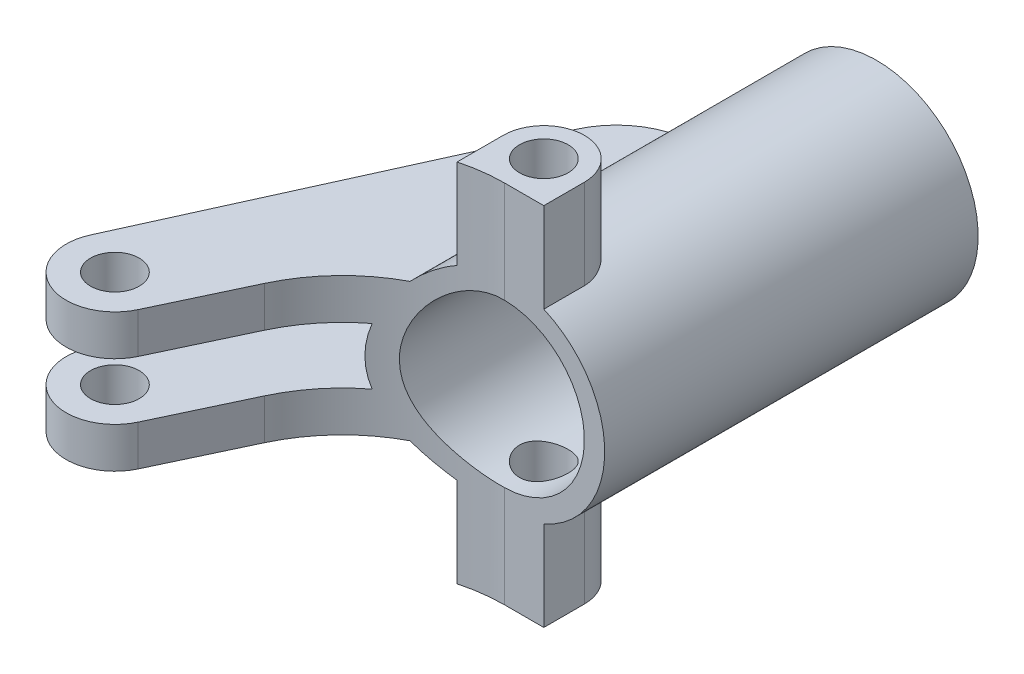
from build123d import *

# Parameters (mm, degrees)
CROQUIS1_R                   = 6.25
CROQUIS1_R_2                 = 5
SALIENTE_EXTRUIR1_DEPTH      = 15
SALIENTE_EXTRUIR2_REACH      = 25.881
SALIENTE_EXTRUIR2_END_RADIUS = 6.25
CROQUIS2_W                   = 5
CROQUIS2_H                   = 5
SALIENTE_EXTRUIR3_REACH      = 29.755
SALIENTE_EXTRUIR3_END_RADIUS = 6.25
CROQUIS3_W                   = 5
CROQUIS3_H                   = 5
CORTAR_EXTRUIR1_REACH        = 29.755
CROQUIS4_R                   = 1.5
REDONDEO1_R                  = 2.5
CROQUIS5_R                   = 1.5
SALIENTE_EXTRUIR4_DEPTH      = 2.5
SALIENTE_EXTRUIR5_REACH      = 34.452
CROQUIS6_W                   = 15
CROQUIS6_H                   = 2.5
CROQUIS7_R                   = 1.5
SALIENTE_EXTRUIR6_DEPTH      = 2.5
SALIENTE_EXTRUIR7_REACH      = 34.452
SALIENTE_EXTRUIR7_END_RADIUS = 6.25
CROQUIS8_W                   = 15
CROQUIS8_H                   = 2.5
REDONDEO2_R                  = 5
REDONDEO4_R                  = 10
SALIENTE_EXTRUIR9_REACH      = 43.224
CROQUIS10_R                  = 6.25
CROQUIS10_R_2                = 5


# Some blends are built 0.0001 mm under size
with BuildPart() as part:
    # Croquis1 → Saliente-Extruir1 (new body)
    with BuildSketch(Plane.XY):
        Circle(CROQUIS1_R)
        Circle(CROQUIS1_R_2, mode=Mode.SUBTRACT)
    extrude(amount=SALIENTE_EXTRUIR1_DEPTH)

    # Saliente-Extruir2: up to this cylinder (the profile starts outside it)
    saliente_extruir2_end = Plane(origin=(0, 0, 12.5), z_dir=(0, 0, -1)) * Cylinder(SALIENTE_EXTRUIR2_END_RADIUS, 65.262, mode=Mode.PRIVATE)
    # Croquis2 → Saliente-Extruir2 (add, up to the surface)
    with BuildSketch(Plane(origin=(0, 11.25, 0), x_dir=(1, 0, 0), z_dir=(0, 1, 0)), mode=Mode.PRIVATE) as saliente_extruir2_sk1:
        with Locations((0, -12.5)):
            Rectangle(CROQUIS2_W, CROQUIS2_H)
    saliente_extruir2_tool1 = extrude(saliente_extruir2_sk1.sketch, amount=-SALIENTE_EXTRUIR2_REACH, mode=Mode.PRIVATE) - saliente_extruir2_end
    add(saliente_extruir2_tool1.solids().sort_by_distance((0, 11.25, 12.5))[0])

    # Saliente-Extruir3: up to this cylinder (the profile starts outside it)
    saliente_extruir3_end = Plane(origin=(0, 0, 12.5), z_dir=(0, 0, -1)) * Cylinder(SALIENTE_EXTRUIR3_END_RADIUS, 73.01, mode=Mode.PRIVATE)
    # Croquis3 → Saliente-Extruir3 (add, up to the surface)
    with BuildSketch(Plane(origin=(0, -11.25, 0), x_dir=(1, 0, 0), z_dir=(0, 1, 0)), mode=Mode.PRIVATE) as saliente_extruir3_sk1:
        with Locations((0, -12.5)):
            Rectangle(CROQUIS3_W, CROQUIS3_H)
    saliente_extruir3_tool1 = extrude(saliente_extruir3_sk1.sketch, amount=SALIENTE_EXTRUIR3_REACH, mode=Mode.PRIVATE) - saliente_extruir3_end
    add(saliente_extruir3_tool1.solids().sort_by_distance((0, -11.25, 12.5))[0])

    # Cortar-Extruir1: up to this face of the body (flat: up to its plane)
    cortar_extruir1_end = Plane(part.part.faces().sort_by_distance((0, -11.25, 12.5))[0])
    # Croquis4 → Cortar-Extruir1 (cut, up to the picked face)
    with BuildSketch(Plane(origin=(0, 11.25, 0), x_dir=(1, 0, 0), z_dir=(0, 1, 0)), mode=Mode.PRIVATE) as cortar_extruir1_sk1:
        with Locations(Location((0, -12.5, 0), (0, 0, 270))):
            Circle(CROQUIS4_R)
    cortar_extruir1_tool1 = split(extrude(cortar_extruir1_sk1.sketch, amount=-CORTAR_EXTRUIR1_REACH, mode=Mode.PRIVATE), bisect_by=cortar_extruir1_end, keep=Keep.BOTH, mode=Mode.PRIVATE)
    add(cortar_extruir1_tool1.solids().sort_by(Axis((0, 11.25, 12.5), (0, -1, 0)))[0], mode=Mode.SUBTRACT)

    # Redondeo1
    redondeo1_edges = [part.edges().sort_by_distance(p)[0] for p in [
        (-2.5, -8.489109809, 10),
        (2.5, -8.489109809, 10),
        (-2.5, 8.489109809, 10),
        (2.5, 8.489109809, 10),
    ]]
    fillet(redondeo1_edges, radius=REDONDEO1_R - 0.0001)  # a hair under: the kernel refuses the full size

    # Croquis6 → Saliente-Extruir5 (add, up to next)
    with BuildSketch(Plane(origin=(-6.25, 0, 0), x_dir=(0, 0, -1), z_dir=(1, 0, 0)), mode=Mode.PRIVATE) as saliente_extruir5_sk1:
        with Locations((-7.5, -3)):
            Rectangle(CROQUIS6_W, CROQUIS6_H)
    saliente_extruir5_tool1 = extrude(saliente_extruir5_sk1.sketch, amount=SALIENTE_EXTRUIR5_REACH, mode=Mode.PRIVATE) - part.part


with BuildPart() as body_2:
    # Croquis5 → Saliente-Extruir4 (new body)
    with BuildSketch(Plane(origin=(0, -4.25, 0), x_dir=(1, 0, 0), z_dir=(0, 1, 0))):
        with BuildLine():
            Line((-6.25, -15), (-11.445879417, -26.033157432))
            ThreePointArc((-11.445879417, -26.033157432), (-15.41753329, -27.478700895), (-16.893124871, -23.518112569))
            Line((-16.893124871, -23.518112569), (-6.25, 0))
            Line((-6.25, 0), (-6.25, -15))
        make_face()
        with Locations(Location((-14.159974768, -24.755, 0), (0, 0, 270))):
            Circle(CROQUIS5_R, mode=Mode.SUBTRACT)
    extrude(amount=SALIENTE_EXTRUIR4_DEPTH)


with BuildPart() as part_1:
    add(part.part)

    add(body_2.part)  # Saliente-Extruir5 merges body 2
    add(saliente_extruir5_tool1.solids().sort_by_distance((-6.25, -3, 7.5))[0])



with BuildPart() as body_2_2:
    # Croquis7 → Saliente-Extruir6 (new body)
    with BuildSketch(Plane(origin=(0, 4.25, 0), x_dir=(1, 0, 0), z_dir=(0, 1, 0))):
        with BuildLine():
            Line((-11.445879417, -26.033157432), (-6.25, -15))
            Line((-6.25, -15), (-6.25, 0))
            Line((-6.25, 0), (-16.893124871, -23.518112569))
            ThreePointArc((-16.893124871, -23.518112569), (-15.41753329, -27.478700895), (-11.445879417, -26.033157432))
        make_face()
        with Locations(Location((-14.159974768, -24.755, 0), (0, 0, 270))):
            Circle(CROQUIS7_R, mode=Mode.SUBTRACT)
    extrude(amount=-SALIENTE_EXTRUIR6_DEPTH)


with BuildPart() as part_2:
    add(part_1.part)

    add(body_2_2.part)  # Saliente-Extruir7 merges body 2 2
    # Saliente-Extruir7: up to this cylinder (the profile starts outside it)
    saliente_extruir7_end = Plane(origin=(0, 0, 7.5), z_dir=(0, 0, -1)) * Cylinder(SALIENTE_EXTRUIR7_END_RADIUS, 82.404, mode=Mode.PRIVATE)
    # Croquis8 → Saliente-Extruir7 (add, up to the surface)
    with BuildSketch(Plane(origin=(-6.25, 0, 0), x_dir=(0, 0, -1), z_dir=(1, 0, 0)), mode=Mode.PRIVATE) as saliente_extruir7_sk1:
        with Locations((-7.5, 3)):
            Rectangle(CROQUIS8_W, CROQUIS8_H)
    saliente_extruir7_tool1 = extrude(saliente_extruir7_sk1.sketch, amount=SALIENTE_EXTRUIR7_REACH, mode=Mode.PRIVATE) - saliente_extruir7_end
    add(saliente_extruir7_tool1.solids().sort_by_distance((-6.25, 3, 7.5))[0])

    # Redondeo2
    # the kernel refuses this fillet: 5 mm, written as the material it takes off along each edge
    with BuildSketch(Plane(origin=(-6.25, 12.313555344, 0), x_dir=(1, 0, 0), z_dir=(0, -1, 0))) as redondeo2_piece_1:
        with BuildLine():
            CenterArc((REDONDEO2_R * 0.645084427485, REDONDEO2_R), REDONDEO2_R, 204.349135832, 65.650864168)
            Line((-REDONDEO2_R * 0.265965606724, REDONDEO2_R * 0.587704189728), (0, 0))
            Line((0, 0), (REDONDEO2_R * 0.645084427485, 0))
        make_face()
    extrude(amount=18.627110687, mode=Mode.SUBTRACT)

    # Redondeo4
    # the kernel refuses this fillet: 10 mm, written as the material it adds along each edge
    with BuildSketch(Plane(origin=(-6.25, 20.110188614, 15), x_dir=(1, 0, 0), z_dir=(0, -1, 0))) as redondeo4_piece_1_section:
        with BuildLine():
            CenterArc((REDONDEO4_R * 0.634407544548, REDONDEO4_R), REDONDEO4_R, 205.2173, 64.7827)
            Line((-REDONDEO4_R * 0.27029090604, REDONDEO4_R * 0.573947522594), (0, 0))
            Line((0, 0), (REDONDEO4_R * 0.634407544548, 0))
        make_face()
    redondeo4_piece_1 = extrude(amount=34.220377227, mode=Mode.PRIVATE)
    redondeo4_piece_1 = split(redondeo4_piece_1, bisect_by=Plane(origin=(-2.5, 8.596165387, 15.10356988), z_dir=(1, 0, 0)), keep=Keep.TOP, mode=Mode.PRIVATE)
    redondeo4_piece_1 = split(redondeo4_piece_1, bisect_by=Plane(origin=(-1.866709216, -11.25, 15.10356988), z_dir=(0, 1, 0)), keep=Keep.TOP, mode=Mode.PRIVATE)
    redondeo4_piece_1 = split(redondeo4_piece_1, bisect_by=Plane(origin=(-1.866709216, 11.25, 15.10356988), z_dir=(0, -1, 0)), keep=Keep.TOP, mode=Mode.PRIVATE)
    redondeo4_piece_1 = redondeo4_piece_1 - Plane(origin=(0, 0, 15.10356988), x_dir=(1, 0, 0), z_dir=(0, 0, -1)) * Cylinder(5, 94, mode=Mode.PRIVATE)
    add(redondeo4_piece_1)
    with BuildSketch(Plane(origin=(-6.25, 4.25, 15), x_dir=(1, 0, 0), z_dir=(0, -1, 0))) as redondeo4_piece_2_section:
        with BuildLine():
            CenterArc((REDONDEO4_R * 0.634407544548, REDONDEO4_R), REDONDEO4_R, 205.2173, 64.7827)
            Line((-REDONDEO4_R * 0.27029090604, REDONDEO4_R * 0.573947522594), (0, 0))
            Line((0, 0), (REDONDEO4_R * 0.634407544548, 0))
        make_face()
    redondeo4_piece_2 = extrude(amount=2.5, mode=Mode.PRIVATE)
    redondeo4_piece_2 = redondeo4_piece_2 - Plane(origin=(0, 0, 16.752062652), x_dir=(1, 0, 0), z_dir=(0, 0, -1)) * Cylinder(5, 31, mode=Mode.PRIVATE)
    add(redondeo4_piece_2)
    with BuildSketch(Plane(origin=(-6.25, 20.110188614, 15), x_dir=(1, 0, 0), z_dir=(0, -1, 0))) as redondeo4_piece_3_section:
        with BuildLine():
            CenterArc((REDONDEO4_R * 0.634407544548, REDONDEO4_R), REDONDEO4_R, 205.2173, 64.7827)
            Line((-REDONDEO4_R * 0.27029090604, REDONDEO4_R * 0.573947522594), (0, 0))
            Line((0, 0), (REDONDEO4_R * 0.634407544548, 0))
        make_face()
    redondeo4_piece_3 = extrude(amount=34.220377227, mode=Mode.PRIVATE)
    redondeo4_piece_3 = redondeo4_piece_3 & Plane(origin=(0, 0, 15.324058302), x_dir=(1, 0, 0), z_dir=(0, 0, -1)) * Cylinder(6.25, 94, mode=Mode.PRIVATE)
    redondeo4_piece_3 = redondeo4_piece_3 - Plane(origin=(0, 0, 15.324058302), x_dir=(1, 0, 0), z_dir=(0, 0, -1)) * Cylinder(5, 94, mode=Mode.PRIVATE)
    add(redondeo4_piece_3)
    with BuildSketch(Plane(origin=(-6.25, 20.110188614, 15), x_dir=(1, 0, 0), z_dir=(0, -1, 0))) as redondeo4_piece_4_section:
        with BuildLine():
            CenterArc((REDONDEO4_R * 0.634407544548, REDONDEO4_R), REDONDEO4_R, 205.2173, 64.7827)
            Line((-REDONDEO4_R * 0.27029090604, REDONDEO4_R * 0.573947522594), (0, 0))
            Line((0, 0), (REDONDEO4_R * 0.634407544548, 0))
        make_face()
    redondeo4_piece_4 = extrude(amount=34.220377227, mode=Mode.PRIVATE)
    redondeo4_piece_4 = split(redondeo4_piece_4, bisect_by=Plane(origin=(-6.508076771, -4.25, 16.752062651), z_dir=(0, 1, 0)), keep=Keep.TOP, mode=Mode.PRIVATE)
    redondeo4_piece_4 = split(redondeo4_piece_4, bisect_by=Plane(origin=(-6.508076771, -1.75, 16.752062651), z_dir=(0, -1, 0)), keep=Keep.TOP, mode=Mode.PRIVATE)
    redondeo4_piece_4 = redondeo4_piece_4 - Plane(origin=(0, 0, 16.752062651), x_dir=(1, 0, 0), z_dir=(0, 0, -1)) * Cylinder(5, 94, mode=Mode.PRIVATE)
    add(redondeo4_piece_4)

    # Croquis10 → Saliente-Extruir9 (add, up to next)
    with BuildSketch(Plane(origin=(0, 0, -8), x_dir=(-1, 0, 0), z_dir=(0, 0, -1)), mode=Mode.PRIVATE) as saliente_extruir9_sk1:
        Circle(CROQUIS10_R)
        Circle(CROQUIS10_R_2, mode=Mode.SUBTRACT)
    saliente_extruir9_tool1 = extrude(saliente_extruir9_sk1.sketch, amount=-SALIENTE_EXTRUIR9_REACH, mode=Mode.PRIVATE) - part_2.part
    add(saliente_extruir9_tool1.solids().sort_by_distance((6.073223, 0, -8))[0])


solid = part_2.part
